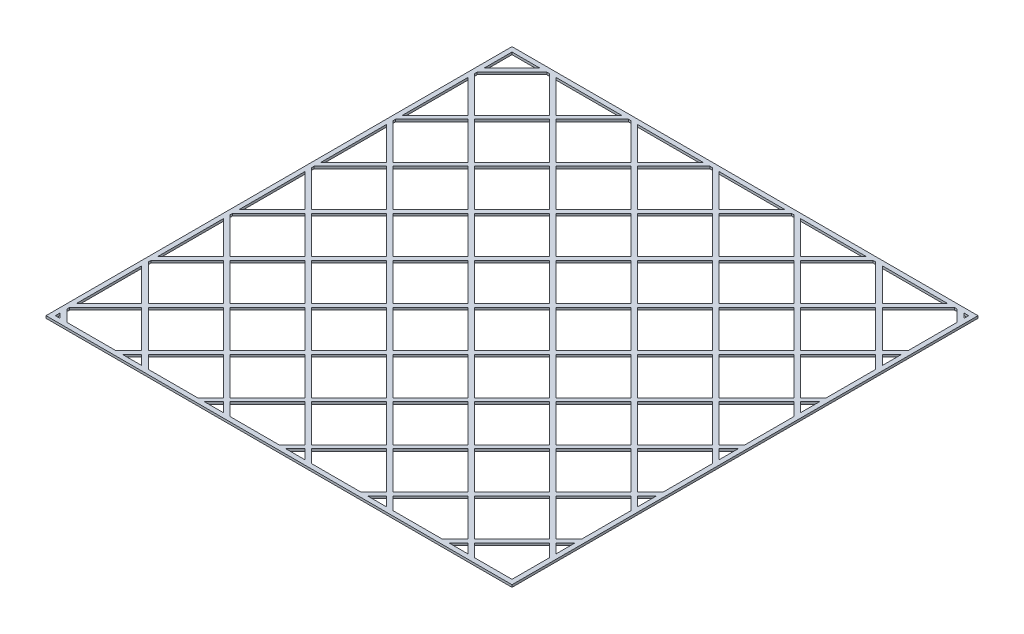
from build123d import *

# Parameters (mm, degrees)
SKETCH1_W            = 1000
SKETCH1_H            = 1000
BOSS_EXTRUDE1_DEPTH  = 2.5
CUT_EXTRUDE1_DEPTH   = 5
LPATTERN1_COUNT      = 6
LPATTERN1_PITCH      = 175
LPATTERN1_COUNT_DIR2 = 6
LPATTERN1_PITCH_DIR2 = 175
SKETCH3_W            = 1000
SKETCH3_H            = 1000
SKETCH3_W_2          = 980
SKETCH3_H_2          = 980
BOSS_EXTRUDE2_DEPTH  = 2.5


with BuildPart() as part:
    # Sketch1 → Boss-Extrude1 (new, symmetric)
    with BuildSketch(Plane(origin=(0, 0, 0), x_dir=(1, 0, 0), z_dir=(0, 1, 0))):
        Rectangle(SKETCH1_W, SKETCH1_H)
    extrude(amount=BOSS_EXTRUDE1_DEPTH, both=True)

    # Sketch2 → Cut-Extrude1 (cut)
    with BuildSketch(Plane(origin=(0, 2.5, 0), x_dir=(1, 0, 0), z_dir=(0, 1, 0))):
        Polygon((-419.571067812, 500), (-500, 500), (-500, 419.571067812), align=None)
        Polygon((-325, 500), (-405.428932188, 500), (-325, 419.571067812), align=None)
        Polygon((-419.571067812, 325), (-500, 405.428932188), (-500, 325), align=None)
        Polygon((-325, 325), (-325, 405.428932188), (-405.428932188, 325), align=None)
        Polygon((-412.5, 332.071067812), (-332.071067812, 412.5), (-412.5, 492.928932188), (-492.928932188, 412.5), align=None)
    cut_extrude1 = extrude(amount=-CUT_EXTRUDE1_DEPTH, mode=Mode.SUBTRACT)

    # LPattern1: Cut-Extrude1 6 × 6
    with Locations(*[(i * LPATTERN1_PITCH, 0, j * LPATTERN1_PITCH_DIR2) for i in range(LPATTERN1_COUNT) for j in range(LPATTERN1_COUNT_DIR2) if (i, j) != (0, 0)]):
        add(cut_extrude1, mode=Mode.SUBTRACT)

    # Sketch3 → Boss-Extrude2 (add, symmetric)
    with BuildSketch(Plane(origin=(0, 0, 0), x_dir=(1, 0, 0), z_dir=(0, 1, 0))):
        Rectangle(SKETCH3_W, SKETCH3_H)
        Rectangle(SKETCH3_W_2, SKETCH3_H_2, mode=Mode.SUBTRACT)
    extrude(amount=BOSS_EXTRUDE2_DEPTH, both=True)


solid = part.part
